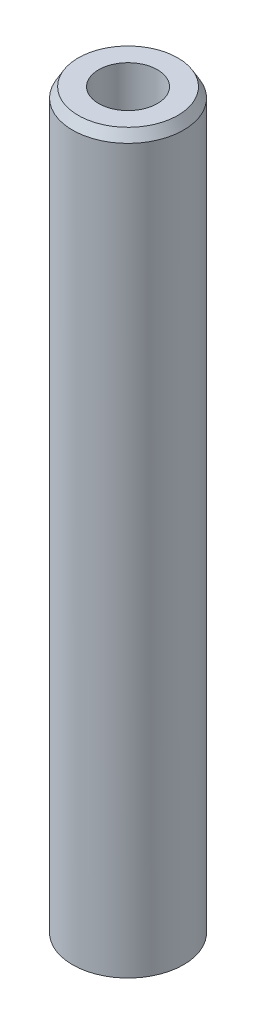
from build123d import *
from OCP.BRepFilletAPI import BRepFilletAPI_MakeChamfer

# Parameters (mm, degrees)
SKETCH1_R           = 5
BOSS_EXTRUDE1_DEPTH = 66.486161818
SKETCH2_R           = 2.643902873
CUT_EXTRUDE1_DEPTH  = 67.861122585
CHAMFER1_SIZE       = 0.890751415
CHAMFER1_SIZE2      = 0.514275569


with BuildPart() as part:
    # Sketch1 → Boss-Extrude1 (new body)
    with BuildSketch(Plane(origin=(0, 0, 0), x_dir=(1, 0, 0), z_dir=(0, 1, 0))):
        Circle(SKETCH1_R)
    extrude(amount=BOSS_EXTRUDE1_DEPTH)

    # Sketch2 → Cut-Extrude1 (cut, through all)
    with BuildSketch(Plane(origin=(0, 0, 0), x_dir=(1, 0, 0), z_dir=(0, 1, 0))):
        Circle(SKETCH2_R)
    extrude(amount=CUT_EXTRUDE1_DEPTH, mode=Mode.SUBTRACT)

    # Chamfer1: one chamfer whose edges measure the first distance from different faces: ONE call of the kernel's chamfer builder (chamfer() names one face for all edges)
    chamfer1_edges_1 = [part.edges().sort_by_distance(p)[0] for p in [
        (-5, 66.486161818, 0),
    ]]
    chamfer1_side_1 = [part.faces().sort_by_distance(p)[0] for p in [
        (-5, 33.243080909, 0),
    ]]
    chamfer1_edges_2 = [part.edges().sort_by_distance(p)[0] for p in [
        (-5, 0, 0),
    ]]
    chamfer1_side_2 = [part.faces().sort_by_distance(p)[0] for p in [
        (-4.858578644, 0, 0),
    ]]
    chamfer1 = BRepFilletAPI_MakeChamfer(part.part.solid().wrapped)
    for e in chamfer1_edges_1:
        chamfer1.Add(CHAMFER1_SIZE, CHAMFER1_SIZE2, e.wrapped, chamfer1_side_1[0].wrapped)  # the first distance lies on this face
    for e in chamfer1_edges_2:
        chamfer1.Add(CHAMFER1_SIZE, CHAMFER1_SIZE2, e.wrapped, chamfer1_side_2[0].wrapped)  # the first distance lies on this face
    add(Compound.cast(chamfer1.Shape()), mode=Mode.REPLACE)


solid = part.part
